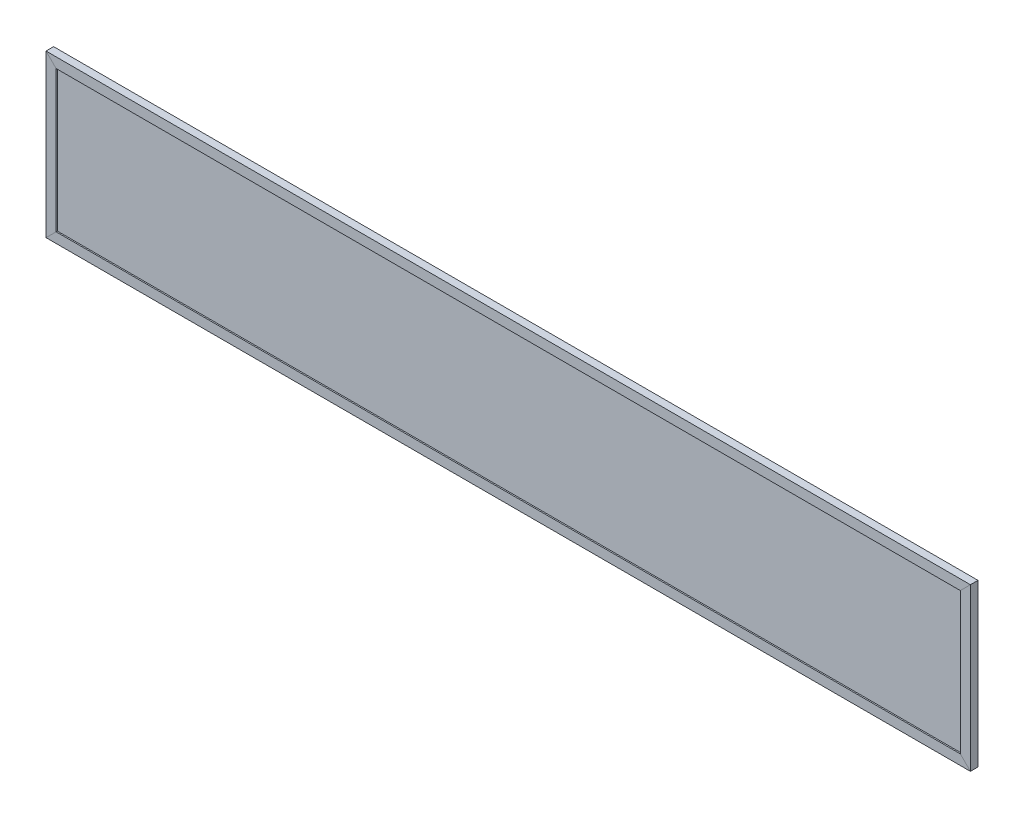
from build123d import *

# Parameters (mm, degrees)
SKETCH2_W               = 1162.05
SKETCH2_H               = 203.2
BOSS_EXTRUDE1_DEPTH     = 4.7625
SKETCH3_W               = 1136.65
SKETCH3_H               = 177.8
CUT_EXTRUDE1_DEPTH      = 612.531705024
CUT_EXTRUDE2_DEPTH      = 3.175
CUT_EXTRUDE2_DEPTH_BACK = 3.175
SKETCH4_W               = 1158.875
SKETCH4_H               = 200.025
SPLIT1_START            = -4.7625
SPLIT1_DEPTH            = 1.5875
SPLIT1_START_2          = 3.175
SPLIT1_2_DEPTH          = 1.5875
SPLIT1_START_3          = -3.175
SPLIT1_3_DEPTH          = 6.35
SPLIT1_4_DEPTH          = 9.525
SPLIT1_5_DEPTH          = 1.5875
SPLIT1_6_DEPTH          = 1.5875
SPLIT1_7_DEPTH          = 6.35
SPLIT1_8_DEPTH          = 1.5875
SPLIT1_9_DEPTH          = 1.5875
SPLIT1_10_DEPTH         = 6.35
SKETCH6_W               = 1155.7
SKETCH6_H               = 196.85
BOSS_EXTRUDE2_DEPTH     = 3.175


# Read off the part's stored shape, not the designer's step: Split1
with BuildPart() as part:
    # Sketch2 → Boss-Extrude1 (new, symmetric)
    with BuildSketch(Plane.XY):
        with Locations((0, 88.9)):
            Rectangle(SKETCH2_W, SKETCH2_H)
    extrude(amount=BOSS_EXTRUDE1_DEPTH, both=True)

    # Sketch3 → Cut-Extrude1 (cut, through all)
    with BuildSketch(Plane.XY.offset(4.7625)):
        with Locations((0, 88.9)):
            Rectangle(SKETCH3_W, SKETCH3_H)
    extrude(amount=-CUT_EXTRUDE1_DEPTH, mode=Mode.SUBTRACT)

    # Sketch4 → Cut-Extrude2 (cut, two sides: drawn at the far end of the back side and taken through both)
    with BuildSketch(Plane.XY.offset(-CUT_EXTRUDE2_DEPTH_BACK)):
        with Locations((0, 88.9)):
            Rectangle(SKETCH4_W, SKETCH4_H)
    extrude(amount=CUT_EXTRUDE2_DEPTH + CUT_EXTRUDE2_DEPTH_BACK, mode=Mode.SUBTRACT)

    # Split1 4 outline → Split1 4 (cut)
    with BuildSketch(Plane.XY.offset(SPLIT1_START)):
        Polygon((581.025, -12.7), (581.025, 190.5), (568.325, 177.8), (568.325, 0), (-568.325, 0), (-568.325, 177.8), (-581.025, 190.5), (-581.025, -12.7), align=None)
    extrude(amount=SPLIT1_4_DEPTH, mode=Mode.SUBTRACT)


with BuildPart() as body_2:
    # Split1 outline → Split1 (new body)
    with BuildSketch(Plane.XY.offset(SPLIT1_START)):
        Polygon((-581.025, 190.5), (-581.025, -12.7), (-568.325, 0), (-568.325, 177.8), align=None)
    extrude(amount=SPLIT1_DEPTH)

    # Split1 2 outline → Split1 2 (add)
    with BuildSketch(Plane.XY.offset(SPLIT1_START_2)):
        Polygon((-581.025, 190.5), (-581.025, -12.7), (-568.325, 0), (-568.325, 177.8), align=None)
    extrude(amount=SPLIT1_2_DEPTH)

    # Split1 3 outline → Split1 3 (add)
    with BuildSketch(Plane.XY.offset(SPLIT1_START_3)):
        Polygon((-579.4375, 188.9125), (-581.025, 190.5), (-581.025, -12.7), (-579.4375, -11.1125), align=None)
    extrude(amount=SPLIT1_3_DEPTH)


with BuildPart() as body_3:
    # Split1 5 outline → Split1 5 (new body)
    with BuildSketch(Plane.XY.offset(SPLIT1_START)):
        Polygon((581.025, -12.7), (581.025, 190.5), (568.325, 177.8), (568.325, 0), align=None)
    extrude(amount=SPLIT1_5_DEPTH)

    # Split1 6 outline → Split1 6 (add)
    with BuildSketch(Plane.XY.offset(SPLIT1_START_2)):
        Polygon((581.025, -12.7), (581.025, 190.5), (568.325, 177.8), (568.325, 0), align=None)
    extrude(amount=SPLIT1_6_DEPTH)

    # Split1 7 outline → Split1 7 (add)
    with BuildSketch(Plane.XY.offset(SPLIT1_START_3)):
        Polygon((579.4375, -11.1125), (581.025, -12.7), (581.025, 190.5), (579.4375, 188.9125), align=None)
    extrude(amount=SPLIT1_7_DEPTH)


with BuildPart() as body_4:
    # Split1 8 outline → Split1 8 (new body)
    with BuildSketch(Plane.XY.offset(SPLIT1_START)):
        Polygon((-581.025, -12.7), (581.025, -12.7), (568.325, 0), (-568.325, 0), align=None)
    extrude(amount=SPLIT1_8_DEPTH)

    # Split1 9 outline → Split1 9 (add)
    with BuildSketch(Plane.XY.offset(SPLIT1_START_2)):
        Polygon((-581.025, -12.7), (581.025, -12.7), (568.325, 0), (-568.325, 0), align=None)
    extrude(amount=SPLIT1_9_DEPTH)

    # Split1 10 outline → Split1 10 (add)
    with BuildSketch(Plane.XY.offset(SPLIT1_START_3)):
        Polygon((-579.4375, -11.1125), (-581.025, -12.7), (581.025, -12.7), (579.4375, -11.1125), align=None)
    extrude(amount=SPLIT1_10_DEPTH)


with BuildPart() as body_5:
    # Sketch6 → Boss-Extrude2 (new, symmetric)
    with BuildSketch(Plane.XY):
        with Locations((0, 88.9)):
            Rectangle(SKETCH6_W, SKETCH6_H)
    extrude(amount=BOSS_EXTRUDE2_DEPTH, both=True)


solid = Compound([part.part, body_2.part, body_3.part, body_4.part, body_5.part])
